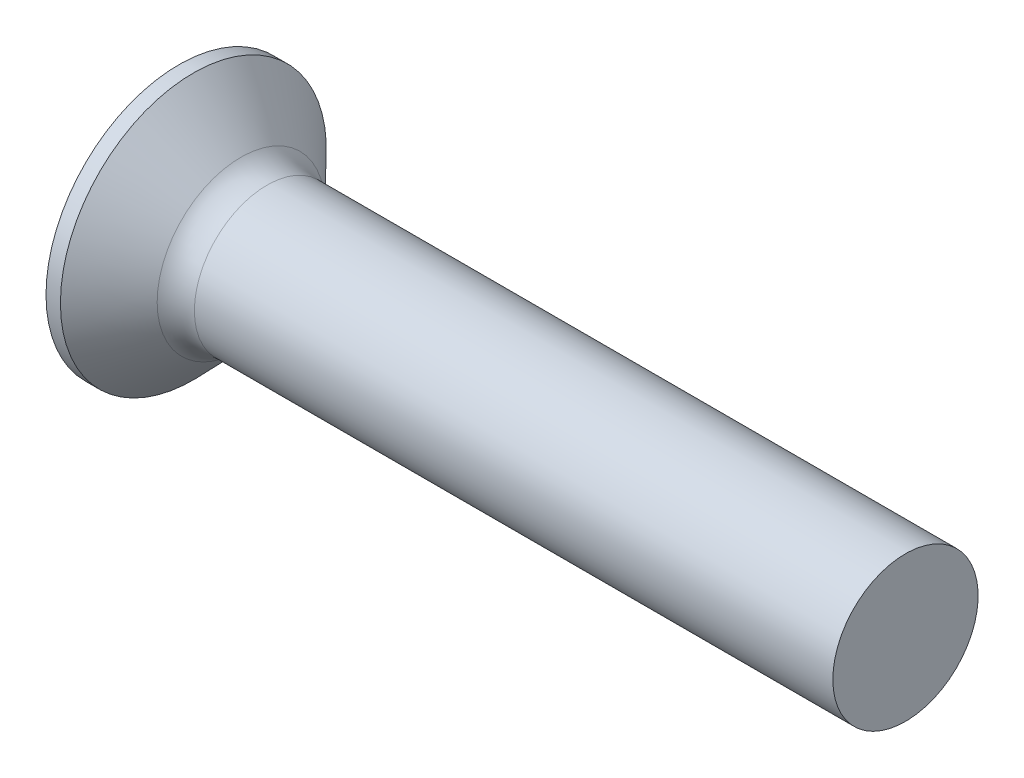
from build123d import *

# Parameters (mm, degrees)
FILLET1_R    = 2.5
RECPAT_COUNT = 2
RECPAT_ANGLE = 90


with BuildPart() as part:
    # BodySke → Base-Revolve (revolve)
    with BuildSketch(Plane.XY):
        Polygon((0, 0), (0, 9.15), (0.992391585, 9.15), (5, 5), (50, 5), (50, 0), align=None)
    revolve(axis=Axis((-6.35, 0, 0), (1, 0, 0)))

    # Fillet1
    fillet1_edges = [part.edges().sort_by_distance(p)[0] for p in [
        (5, -5, 0),
    ]]
    fillet(fillet1_edges, radius=FILLET1_R)

    # Sketch3 → Recess section 0
    with BuildSketch(Plane.ZY):
        with BuildLine():
            Line((-1.08, 4.9), (1.08, 4.9))
            Line((1.08, 4.9), (1.08, -4.9))
            Line((1.08, -4.9), (-1.08, -4.9))
            Line((-1.08, -4.9), (-1.08, 4.9))
        make_face()
    # Sketch4 → Recess section 1
    with BuildSketch(Plane.ZY.offset(-5.64)):
        with BuildLine():
            Line((-1.08, 2.088000201), (1.08, 2.088000201))
            Line((1.08, 2.088000201), (1.08, -2.088000201))
            Line((1.08, -2.088000201), (-1.08, -2.088000201))
            Line((-1.08, -2.088000201), (-1.08, 2.088000201))
        make_face()
    recess = loft(mode=Mode.SUBTRACT)

    # RecPat: Recess ×2 about axis
    recpat_axis = Axis((-6.35, 0, 0), (1, 0, 0))
    for i in range(1, RECPAT_COUNT):
        add(recess.rotate(recpat_axis, i * RECPAT_ANGLE / (RECPAT_COUNT - 1)), mode=Mode.SUBTRACT)

    # RecCorSke → RecessCore (revolve, cut)
    with BuildSketch(Plane.XY):
        Polygon((0, 0), (0, 2.324887219), (5.64, 1.9305), (6.267257474, 0), align=None)
    revolve(axis=Axis((-3.175, 0, 0), (1, 0, 0)), mode=Mode.SUBTRACT)


solid = part.part
